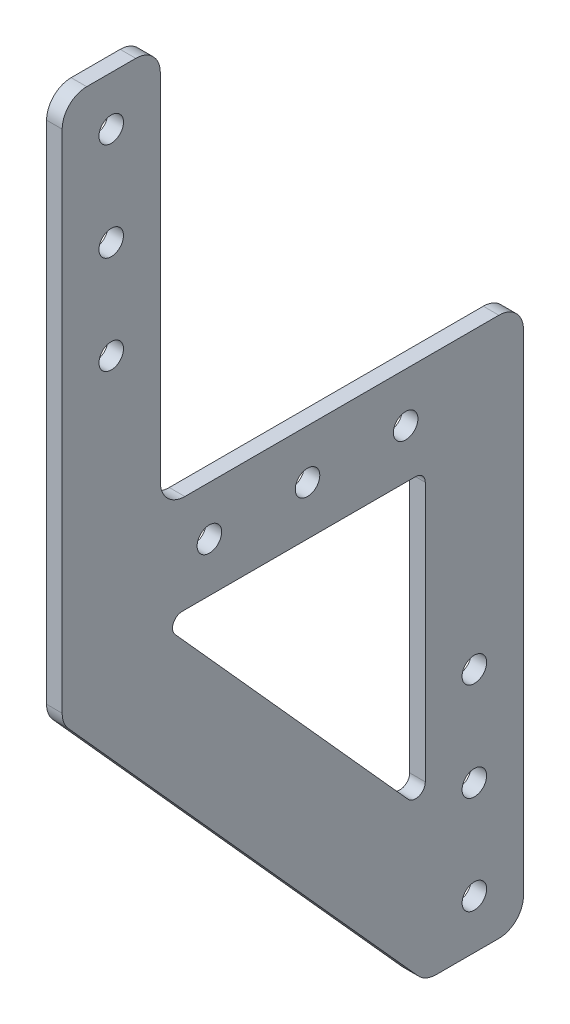
from build123d import *
from OCP.BRepFilletAPI import BRepFilletAPI_MakeFillet

# Parameters (mm, degrees)
SKETCH2_R           = 2.5
BOSS_EXTRUDE1_DEPTH = 3.175
FILLET1_R1          = 5
FILLET1_R2          = 2


with BuildPart() as part:
    # Sketch2 → Boss-Extrude1 (new body)
    with BuildSketch(Plane(origin=(0, 0, 0), x_dir=(0, 0, -1), z_dir=(1, 0, 0))):
        Polygon((-47, 92.332955895), (-27, 92.332955895), (-27, 10), (47, 10), (47, -100), (27, -100), (-47, -17.667044105), align=None)
        with Locations((-37, 82.332955895)):
            Circle(SKETCH2_R, mode=Mode.SUBTRACT)
        with Locations((-37, 62.332955895)):
            Circle(SKETCH2_R, mode=Mode.SUBTRACT)
        with Locations((-37, 42.332955895)):
            Circle(SKETCH2_R, mode=Mode.SUBTRACT)
        with Locations((37, -90)):
            Circle(SKETCH2_R, mode=Mode.SUBTRACT)
        with Locations((37, -70)):
            Circle(SKETCH2_R, mode=Mode.SUBTRACT)
        with Locations((37, -50)):
            Circle(SKETCH2_R, mode=Mode.SUBTRACT)
        with Locations((-17, 0)):
            Circle(SKETCH2_R, mode=Mode.SUBTRACT)
        with Locations((3, 0)):
            Circle(SKETCH2_R, mode=Mode.SUBTRACT)
        with Locations((23, 0)):
            Circle(SKETCH2_R, mode=Mode.SUBTRACT)
        Polygon((27, -70.080805653), (27, -10), (-27, -10), align=None, mode=Mode.SUBTRACT)
    extrude(amount=BOSS_EXTRUDE1_DEPTH)

    # Fillet1: one fillet with a radius per group of edges: ONE call of the kernel's fillet builder (fillet() takes one radius for all edges)
    fillet1_edges_1 = [part.edges().sort_by_distance(p)[0] for p in [
        (1.5875, 92.332955895, 47),
        (1.5875, 92.332955895, 27),
        (1.5875, 10, 27),
        (1.5875, 10, -47),
        (1.5875, -100, -47),
        (1.5875, -100, -27),
        (1.5875, -17.667044105, 47),
    ]]
    fillet1_edges_2 = [part.edges().sort_by_distance(p)[0] for p in [
        (1.5875, -10, -27),
        (1.5875, -10, 27),
        (1.5875, -70.080805653, -27),
    ]]
    fillet1 = BRepFilletAPI_MakeFillet(part.part.solid().wrapped)
    for e in fillet1_edges_1:
        fillet1.Add(FILLET1_R1, e.wrapped)
    for e in fillet1_edges_2:
        fillet1.Add(FILLET1_R2, e.wrapped)
    add(Compound.cast(fillet1.Shape()), mode=Mode.REPLACE)


solid = part.part
